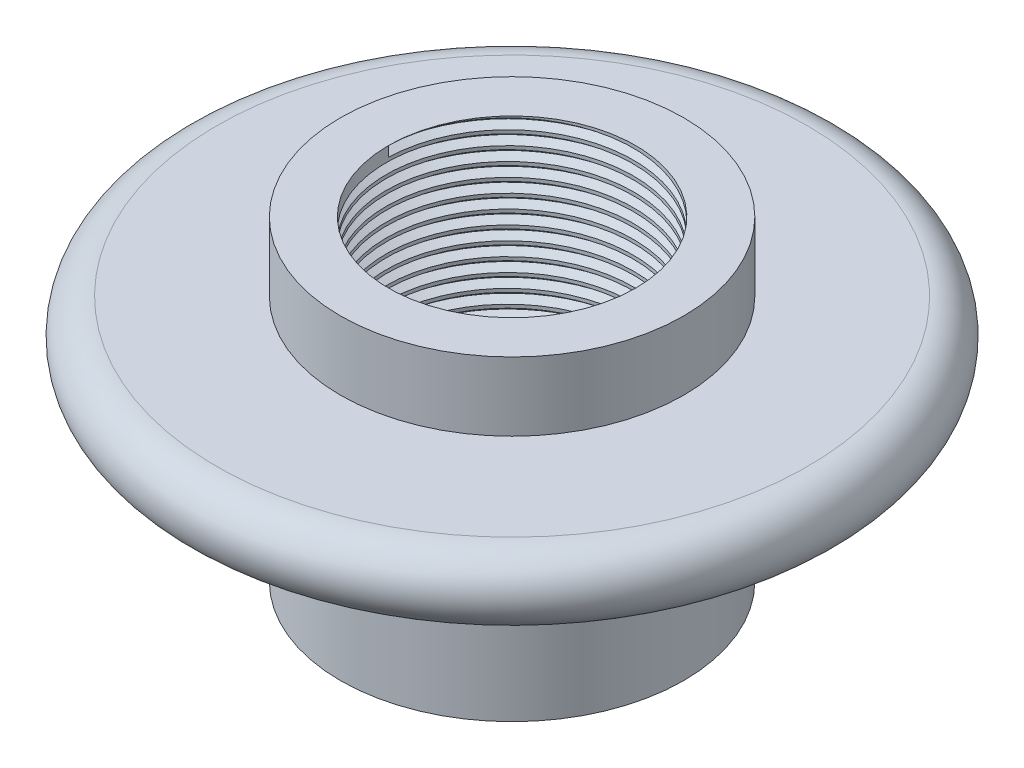
from build123d import *

# Parameters (mm, degrees)
THREAD1_PITCH = 2


with BuildPart() as part:
    # Sketch1 → Revolve1 (revolve)
    with BuildSketch(Plane.XY, mode=Mode.PRIVATE) as revolve1_sk:
        with BuildLine():
            Line((18, 46), (18, 0))
            Line((18, 0), (25, 0))
            Line((25, 0), (25, 26))
            Line((25, 26), (43, 26))
            ThreePointArc((43, 26), (48, 31), (43, 36))
            Line((43, 36), (25, 36))
            Line((25, 36), (25, 46))
            Line((25, 46), (18, 46))
        make_face()
    revolve(revolve1_sk.sketch.rotate(Axis((0, 0, 0), (0, 1, 0)), 90), axis=Axis((0, 0, 0), (0, 1, 0)))

    # Thread1: the profile of Thread Profile1 profile screwed along a right-hand helix of 23 turns, 10 arcs to a turn; built about Z, then put on its axis
    thread1_z = Axis((0, 0, 0), (0, 0, 1))
    thread1_corners = [(17.9997, 0, -0.000173205), (19.08253175, 0, 0.624999997), (19.08253175, 0, 0.874999997), (17.9997, 0, 1.5001732)]
    with BuildLine(mode=Mode.PRIVATE) as thread1_profile:
        Line(thread1_corners[0], thread1_corners[1])
        Line(thread1_corners[1], thread1_corners[2])
        Line(thread1_corners[2], thread1_corners[3])
        Line(thread1_corners[3], thread1_corners[0])
    thread1_cap = Face(thread1_profile.wire())
    thread1_turn_angles = [0, 18, 36, 54, 72, 90, 108, 126, 144, 162, 180, 198, 216, 234, 252, 270, 288, 306, 324, 342, 360]
    thread1_turn_weights = [1, 0.9510565162951535, 1, 0.9510565162951535, 1, 0.9510565162951535, 1, 0.9510565162951535, 1, 0.9510565162951535, 1, 0.9510565162951535, 1, 0.9510565162951535, 1, 0.9510565162951535, 1, 0.9510565162951535, 1, 0.9510565162951535, 1]
    thread1_turn_rails = [Edge.make_bspline([Vector(p[0], p[1], 0).rotate(thread1_z, thread1_turn_angles[k]) / thread1_turn_weights[k] + Vector(0, 0, p[2] + THREAD1_PITCH * thread1_turn_angles[k] / 360) for k in range(21)], [0, 0, 0, 1, 1, 2, 2, 3, 3, 4, 4, 5, 5, 6, 6, 7, 7, 8, 8, 9, 9, 10, 10, 10], 2, thread1_turn_weights) for p in thread1_corners]
    thread1_turn_sides = [Face.make_surface_from_curves(thread1_turn_rails[p[0]], thread1_turn_rails[p[1]]) for p in [(0, 1), (1, 2), (2, 3), (3, 0)]]
    thread1 = Plane(origin=(0, 46, 0), x_dir=(-1, 0, 0), z_dir=(0, -1, 0)) * Solid(Shell([*[p.moved(Location((0, 0, THREAD1_PITCH * i))) for i in range(23) for p in thread1_turn_sides], thread1_cap, thread1_cap.rotate(thread1_z, 8280).moved(Location((0, 0, THREAD1_PITCH * 8280 / 360)))]))
    add(thread1, mode=Mode.SUBTRACT)


solid = part.part
